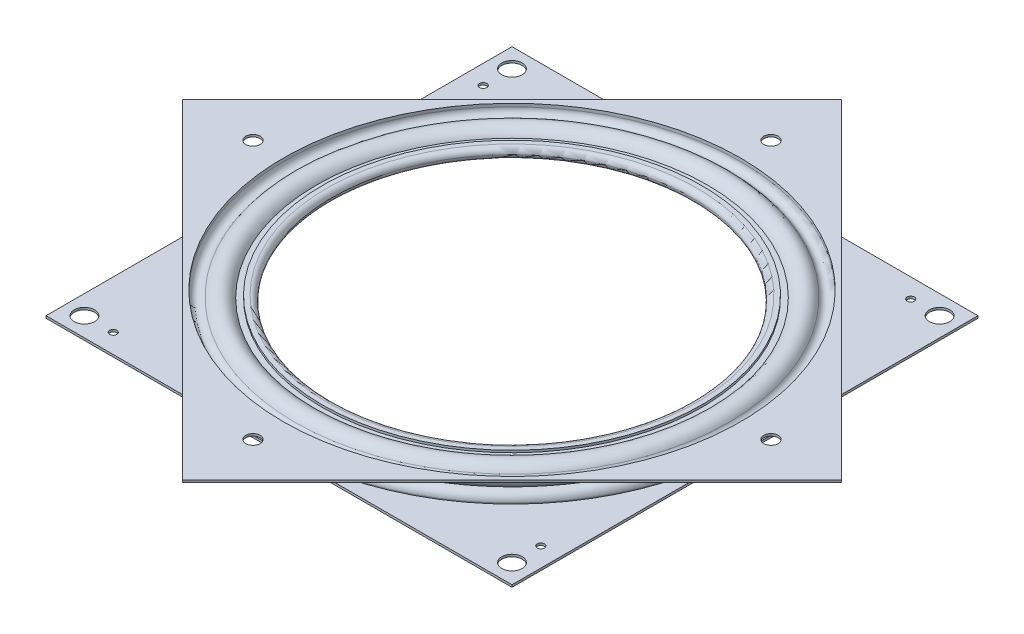
from build123d import *

# Parameters (mm, degrees)
SKETCH2_W                                 = 154.0002
SKETCH2_H                                 = 154.0002
SKETCH2_R                                 = 75.529340861
EXTRUDE1_DEPTH                            = 0.7366
EXTRUDE2_START                            = -0.7366
SKETCH3_R                                 = 75.529340861
EXTRUDE2_DEPTH                            = 0.7366
CIRPATTERN1_COUNT                         = 4
SKETCH5_W                                 = 3.3782
SKETCH5_H                                 = 0.7366
F_5_32_0_156250_DIAMETER_HOLE1_AT_2_COUNT = 2
F_5_32_0_156250_DIAMETER_HOLE1_AT_2_PITCH = 141.3002
F_5_32_0_156250_DIAMETER_HOLE1_AT_3_COUNT = 2
F_5_32_0_156250_DIAMETER_HOLE1_AT_3_PITCH = 141.3002
F_5_32_0_156250_DIAMETER_HOLE1_AT_4_COUNT = 2
F_5_32_0_156250_DIAMETER_HOLE1_AT_4_PITCH = 199.828659206
SKETCH7_W                                 = 2.3876
SKETCH7_H                                 = 8.128
F_5_32_0_156250_DIAMETER_HOLE2_AT_2_COUNT = 2
F_5_32_0_156250_DIAMETER_HOLE2_AT_2_PITCH = 121.0564
F_5_32_0_156250_DIAMETER_HOLE2_AT_3_COUNT = 2
F_5_32_0_156250_DIAMETER_HOLE2_AT_3_PITCH = 171.199602692
F_5_32_0_156250_DIAMETER_HOLE2_AT_4_COUNT = 2
F_5_32_0_156250_DIAMETER_HOLE2_AT_4_PITCH = 121.0564
SKETCH9_R                                 = 1.1938
CUT_EXTRUDE1_DEPTH                        = 155.17747694
CIRPATTERN2_COUNT                         = 4


# Read off the part's stored shape, not the designer's step: Revolve-Thin5
with BuildPart() as part:
    # Sketch1 → Revolve-Thin4 (revolve)
    with BuildSketch(Plane.XY, mode=Mode.PRIVATE) as revolve_thin4_sk:
        with BuildLine():
            Line((62.74854946, 1.778), (61.214, 1.778))
            ThreePointArc((61.214, 1.778), (59.436, 0), (61.214, -1.778))
            Line((61.214, -1.778), (64.28309892, -1.778))
            ThreePointArc((64.28309892, -1.778), (67.669225582, -4.788771381), (71.737577241, -2.794))
            ThreePointArc((71.737577241, -2.794), (74.023261161, -1.847238721), (75.529340861, -3.81))
            Line((75.529340861, -3.81), (75.529340861, -4.826))
            Line((75.529340861, -4.826), (77.0001, -4.826))
            Line((77.0001, -4.826), (77.0001, -4.0894))
            Line((77.0001, -4.0894), (76.265940861, -4.0894))
            Line((76.265940861, -4.0894), (76.265940861, -3.81))
            ThreePointArc((76.265940861, -3.81), (74.21390727, -1.135737757), (71.099662929, -2.4257))
            ThreePointArc((71.099662929, -2.4257), (67.492675346, -4.00937161), (64.902401285, -1.0414))
            Line((64.902401285, -1.0414), (61.214, -1.0414))
            ThreePointArc((61.214, -1.0414), (60.1726, 0), (61.214, 1.0414))
            Line((61.214, 1.0414), (62.74854946, 1.0414))
            Line((62.74854946, 1.0414), (62.74854946, 1.778))
        make_face()
    revolve(revolve_thin4_sk.sketch.rotate(Axis((0, 21.71272626, 0), (0, -1, 0)), 90), axis=Axis((0, 21.71272626, 0), (0, -1, 0)))

    # Sketch2 → Extrude1 (add)
    with BuildSketch(Plane.XZ.offset(4.826)):
        Rectangle(SKETCH2_W, SKETCH2_H)
        with Locations(Location((0, 0, 0), (0, 0, 90))):
            Circle(SKETCH2_R, mode=Mode.SUBTRACT)
    extrude(amount=-EXTRUDE1_DEPTH)

    # Sketch5 → 5/32 (0.156250) Diameter Hole1 (revolve, cut)
    with BuildSketch(Plane(origin=(70.6501, -4.0894, -70.6501), x_dir=(0, 0, 1), z_dir=(1, 0, 0))):
        with Locations((1.6891, 0.3683)):
            Rectangle(SKETCH5_W, SKETCH5_H)
    f_5_32_0_156250_diameter_hole1 = revolve(axis=Axis((70.6501, 2.2606, -70.6501), (0, -1, 0)), mode=Mode.SUBTRACT)

    # 5/32 (0.156250) Diameter Hole1 at 2: 5/32 (0.156250) Diameter Hole1 ×2
    with Locations(*[(0, 0, i * F_5_32_0_156250_DIAMETER_HOLE1_AT_2_PITCH) for i in range(1, F_5_32_0_156250_DIAMETER_HOLE1_AT_2_COUNT)]):
        add(f_5_32_0_156250_diameter_hole1, mode=Mode.SUBTRACT)

    # 5/32 (0.156250) Diameter Hole1 at 3: 5/32 (0.156250) Diameter Hole1 ×2
    with Locations(*[(-i * F_5_32_0_156250_DIAMETER_HOLE1_AT_3_PITCH, 0, 0) for i in range(1, F_5_32_0_156250_DIAMETER_HOLE1_AT_3_COUNT)]):
        add(f_5_32_0_156250_diameter_hole1, mode=Mode.SUBTRACT)

    # 5/32 (0.156250) Diameter Hole1 at 4: 5/32 (0.156250) Diameter Hole1 ×2
    with Locations(*[Vector(-0.7071067811865476, 0, 0.7071067811865476) * (i * F_5_32_0_156250_DIAMETER_HOLE1_AT_4_PITCH) for i in range(1, F_5_32_0_156250_DIAMETER_HOLE1_AT_4_COUNT)]):
        add(f_5_32_0_156250_diameter_hole1, mode=Mode.SUBTRACT)

    # Sketch9 → Cut-Extrude1 (cut, through all)
    with BuildSketch(Plane(origin=(0, -4.0894, 0), x_dir=(-1, 0, 0), z_dir=(0, 1, 0))):
        with Locations(Location((-70.6501, 61.1251, 0), (0, 0, 90))):
            Circle(SKETCH9_R)
    cut_extrude1 = extrude(amount=-CUT_EXTRUDE1_DEPTH, mode=Mode.SUBTRACT)

    # CirPattern2: Cut-Extrude1 ×4 about axis
    cirpattern2_axis = Axis((0, 0, 0), (0, 1, 0))
    for i in range(1, CIRPATTERN2_COUNT):
        add(cut_extrude1.rotate(cirpattern2_axis, i * 360 / CIRPATTERN2_COUNT), mode=Mode.SUBTRACT)


with BuildPart() as body_2:
    # Revolve-Thin5 outline → Revolve-Thin5 (revolve)
    with BuildSketch(Plane.XY):
        with BuildLine():
            Line((77.0001, 3.302), (75.529340861, 3.302))
            Line((75.529340861, 3.302), (75.529340861, 2.286))
            ThreePointArc((75.529340861, 2.286), (74.023261161, 0.323238721), (71.737577241, 1.27))
            ThreePointArc((71.737577241, 1.27), (68.088390068, 3.299931105), (64.576093872, 1.0414))
            Line((64.576093872, 1.0414), (61.214, 1.0414))
            Line((61.214, 1.0414), (61.214, 0.3048))
            Line((61.214, 0.3048), (65.066299927, 0.3048))
            ThreePointArc((65.066299927, 0.3048), (67.890458911, 2.54923464), (71.099662929, 0.9017))
            ThreePointArc((71.099662929, 0.9017), (74.21390727, -0.388262243), (76.265940861, 2.286))
            Line((76.265940861, 2.286), (76.265940861, 2.5654))
            Line((76.265940861, 2.5654), (77.0001, 2.5654))
            Line((77.0001, 2.5654), (77.0001, 3.302))
        make_face()
    revolve(axis=Axis((0, 0, 0), (0, 1, 0)))

    # Sketch3 → Extrude2 (add)
    with BuildSketch(Plane(origin=(0, 3.302, 0), x_dir=(-1, 0, 0), z_dir=(0, 1, 0)).offset(EXTRUDE2_START)):
        Polygon((0, -108.894585724), (108.894585724, 0), (0, 108.894585724), (-108.894585724, 0), align=None)
        with Locations(Location((0, 0, 0), (0, 0, 90))):
            Circle(SKETCH3_R, mode=Mode.SUBTRACT)
    extrude(amount=EXTRUDE2_DEPTH)

    # Sketch7 → 5/32 (0.156250) Diameter Hole2 (revolve, cut)
    with BuildSketch(Plane(origin=(85.599801346, 3.302, 0), x_dir=(0, 0, 1), z_dir=(1, 0, 0))):
        with Locations((1.1938, 4.064)):
            Rectangle(SKETCH7_W, SKETCH7_H)
    f_5_32_0_156250_diameter_hole2 = revolve(axis=Axis((85.599801346, 9.652, 0), (0, -1, 0)), mode=Mode.SUBTRACT)

    # 5/32 (0.156250) Diameter Hole2 at 2: 5/32 (0.156250) Diameter Hole2 ×2
    with Locations(*[Vector(-0.7071067811865476, 0, -0.7071067811865476) * (i * F_5_32_0_156250_DIAMETER_HOLE2_AT_2_PITCH) for i in range(1, F_5_32_0_156250_DIAMETER_HOLE2_AT_2_COUNT)]):
        add(f_5_32_0_156250_diameter_hole2, mode=Mode.SUBTRACT)

    # 5/32 (0.156250) Diameter Hole2 at 3: 5/32 (0.156250) Diameter Hole2 ×2
    with Locations(*[(-i * F_5_32_0_156250_DIAMETER_HOLE2_AT_3_PITCH, 0, 0) for i in range(1, F_5_32_0_156250_DIAMETER_HOLE2_AT_3_COUNT)]):
        add(f_5_32_0_156250_diameter_hole2, mode=Mode.SUBTRACT)

    # 5/32 (0.156250) Diameter Hole2 at 4: 5/32 (0.156250) Diameter Hole2 ×2
    with Locations(*[Vector(-0.7071067811865476, 0, 0.7071067811865476) * (i * F_5_32_0_156250_DIAMETER_HOLE2_AT_4_PITCH) for i in range(1, F_5_32_0_156250_DIAMETER_HOLE2_AT_4_COUNT)]):
        add(f_5_32_0_156250_diameter_hole2, mode=Mode.SUBTRACT)


with BuildPart() as body_3:
    # Sketch4 → Revolve1 (revolve)
    with BuildSketch(Plane.XY):
        with BuildLine():
            Line((68.21805, 2.5146), (68.21805, -4.0386))
            ThreePointArc((68.21805, -4.0386), (71.49465, -0.762), (68.21805, 2.5146))
        make_face()
    revolve(axis=Axis((68.21805, 2.837450101, 0), (0, -1, 0)))


with BuildPart() as cirpattern1_1:
    # CirPattern1: pattern copy
    add(body_3.part.rotate(Axis((0, 0, 0), (0, 1, 0)), 1 * 360 / CIRPATTERN1_COUNT))


with BuildPart() as cirpattern1_2:
    # CirPattern1: pattern copy
    add(body_3.part.rotate(Axis((0, 0, 0), (0, 1, 0)), 2 * 360 / CIRPATTERN1_COUNT))


with BuildPart() as cirpattern1_3:
    # CirPattern1: pattern copy
    add(body_3.part.rotate(Axis((0, 0, 0), (0, 1, 0)), 3 * 360 / CIRPATTERN1_COUNT))


solid = Compound([part.part, body_2.part, body_3.part, cirpattern1_1.part, cirpattern1_2.part, cirpattern1_3.part])
